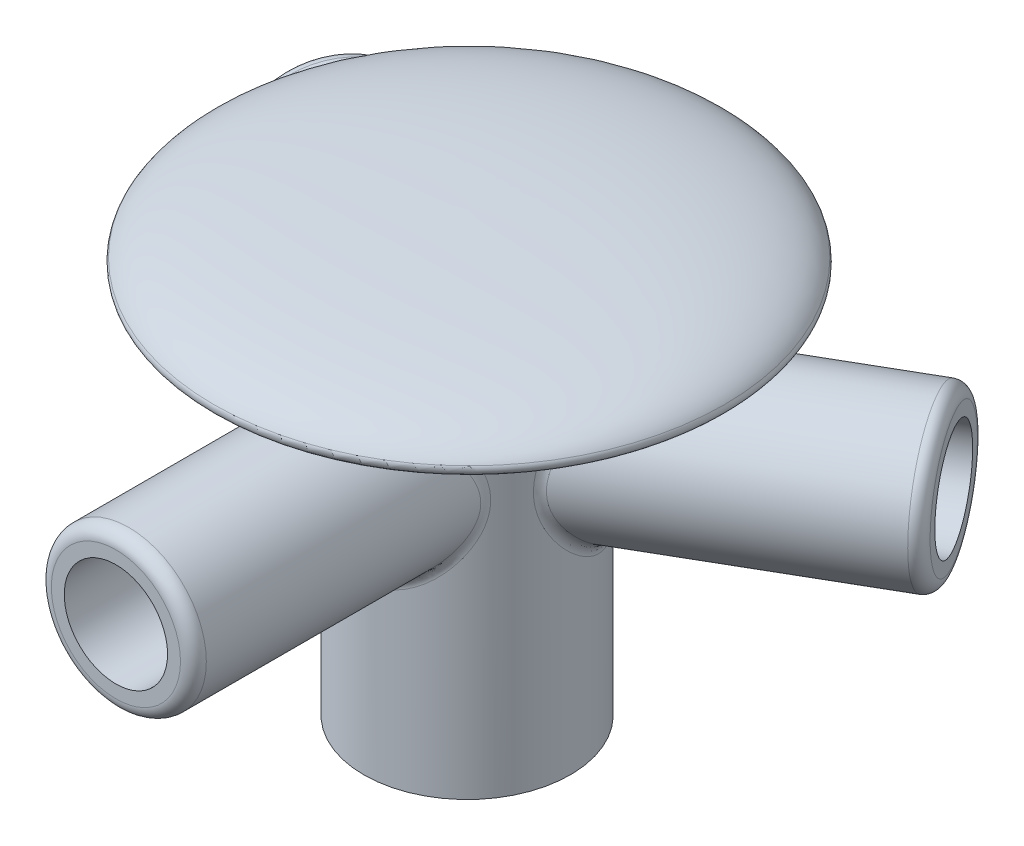
from build123d import *

# Parameters (mm, degrees)
SKETCH1_R                = 4
BOSS_EXTRUDE1_DEPTH      = 15
BOSS_EXTRUDE2_OUTLINE_W  = 3
BOSS_EXTRUDE2_OUTLINE_H  = 11.291489702
FILLET1_R                = 0.5
SKETCH7_R                = 2
CUT_EXTRUDE2_DEPTH       = 8
CIRPATTERN1_COUNT        = 3
FILLET1_OF_CIRPATTERN1_R = 0.5
SKETCH3_R                = 2.5
CUT_EXTRUDE1_DEPTH       = 25.354662248
FILLET2_R                = 0.25


# Read off the part's stored shape, not the designer's step: Boss-Extrude2
with BuildPart() as part:
    # Sketch1 → Boss-Extrude1 (new body)
    with BuildSketch(Plane(origin=(0, 0, 0), x_dir=(1, 0, 0), z_dir=(0, 1, 0))):
        with Locations(Location((-0.080116936, 0, 0), (0, 0, 270))):
            Circle(SKETCH1_R)
    extrude(amount=BOSS_EXTRUDE1_DEPTH)

    # Boss-Extrude2 outline → Boss-Extrude2 (revolve)
    with BuildSketch(Plane(origin=(0.074659454, 10, 0), x_dir=(1, 0, 0), z_dir=(0, -1, 0))):
        with Locations((1.5, 8.104255149)):
            Rectangle(BOSS_EXTRUDE2_OUTLINE_W, BOSS_EXTRUDE2_OUTLINE_H)
    boss_extrude2 = revolve(axis=Axis((0.074659454, 10, 0), (0, 0, 1)))

    # Fillet1
    fillet1_edges = [part.edges().sort_by_distance(p)[0] for p in [
        (2.159951247, 12.156747114, 3.313924339),
        (-2.925340546, 10, 13.75),
    ]]
    fillet(fillet1_edges, radius=FILLET1_R)

    # Sketch7 → Cut-Extrude2 (cut)
    with BuildSketch(Plane.XY.offset(13.75)):
        with Locations((0.074659454, 10)):
            Circle(SKETCH7_R)
    cut_extrude2 = extrude(amount=-CUT_EXTRUDE2_DEPTH, mode=Mode.SUBTRACT)

    # CirPattern1: Boss-Extrude2, Cut-Extrude2 ×3 about axis
    cirpattern1_axis = Axis((-0.080116936, 15, 0), (0, 1, 0))
    add([boss_extrude2.rotate(cirpattern1_axis, i * 360 / CIRPATTERN1_COUNT) for i in range(1, CIRPATTERN1_COUNT)])
    add([cut_extrude2.rotate(cirpattern1_axis, i * 360 / CIRPATTERN1_COUNT) for i in range(1, CIRPATTERN1_COUNT)], mode=Mode.SUBTRACT)

    # Fillet1 of CirPattern1
    fillet1_of_cirpattern1_edges = [part.edges().sort_by_distance(p)[0] for p in [
        (1.669791636, 12.156747114, -3.596918123),
        (13.250344171, 10, -4.410964074),
        (-4.070093692, 12.156747114, 0.282993783),
        (-10.565354433, 10, -9.339035926),
    ]]
    fillet(fillet1_of_cirpattern1_edges, radius=FILLET1_OF_CIRPATTERN1_R)

    # Sketch3 → Cut-Extrude1 (cut, through all)
    with BuildSketch(Plane.XZ):
        with Locations(Location((0, 0, 0), (0, 0, 270))):
            Circle(SKETCH3_R)
    extrude(amount=-CUT_EXTRUDE1_DEPTH, mode=Mode.SUBTRACT)

    # Sketch5 → Revolve1 (revolve)
    with BuildSketch(Plane(origin=(0, 0, 0), x_dir=(0, 0, -1), z_dir=(1, 0, 0))):
        with BuildLine():
            Line((0, 15), (-10, 15))
            add(Edge.make_bspline(
                [(0, 17), (-9.908401336, 16.942798838), (-10, 15)],
                knots=[0, 0, 0, 1, 1, 1], degree=2))
            Line((0, 17), (0, 15))
        make_face()
    revolve(axis=Axis((0, 15, 0), (0, 1, 0)))

    # Fillet2
    fillet2_edges = [part.edges().sort_by_distance(p)[0] for p in [
        (0, 15, -10),
    ]]
    fillet(fillet2_edges, radius=FILLET2_R)


solid = part.part
